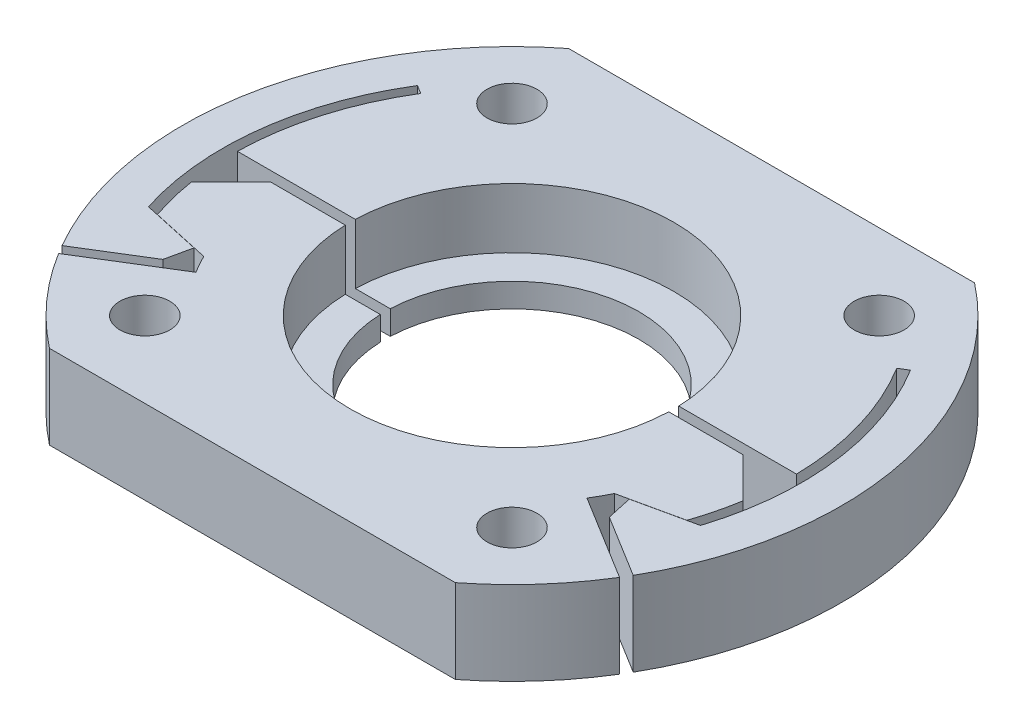
from build123d import *

# Parameters (mm, degrees)
SKETCH4_R            = 1.2
CUT_EXTRUDE2_DEPTH   = 27.711420778
SKETCH4_3_R          = 2.25
SKETCH4_3_R_2        = 1.2
CUT_EXTRUDE3_DEPTH   = 9.4
CHAMFER1_SIZE        = 1
SKETCH2_W            = 41.708786628
SKETCH2_H            = 54.576605706
CUT_EXTRUDE1_DEPTH   = 0.05
SKETCH1_5_W          = 8.4
SKETCH1_5_H          = 3
SKETCH1_5_H_2        = 1.2
SKETCH10_R           = 1.25
CUT_EXTRUDE9_DEPTH   = 24.951200387
CUT_EXTRUDE6_START   = -5.4
CUT_EXTRUDE6_DEPTH   = 5.4
CUT_EXTRUDE7_DEPTH   = 1.2
SKETCH11_OUTSIDE_W   = 44.372
SKETCH11_OUTSIDE_H   = 44.372
SKETCH11_OUTSIDE_W_2 = 60
SKETCH11_OUTSIDE_H_2 = 26
CUT_EXTRUDE10_DEPTH  = 24.70949177


# Read off the part's stored shape, not the designer's step: Cut-Extrude6
with BuildPart() as part:
    # Sketch1 → Revolve1 (revolve)
    with BuildSketch(Plane.XY, mode=Mode.PRIVATE) as revolve1_sk:
        Polygon((-3, 0), (-8, 0), (-8, -3.7), (-6, -3.7), (-6, -9.7), (-8, -9.7), (-8, -13), (-16.5, -13), (-16.5, -23.9), (-6.1, -23.9), (-6.1, -21), (-8.1, -21), (-8.1, -14.3), (-3, -14.3), align=None)
    revolve(revolve1_sk.sketch.rotate(Axis((0, 21.737527327, 0), (0, -1, 0)), 270), axis=Axis((0, 21.737527327, 0), (0, -1, 0)))

    # Sketch4 → Cut-Extrude2 (cut, through all)
    with BuildSketch(Plane(origin=(0, -13, 0), x_dir=(1, 0, 0), z_dir=(0, 1, 0))):
        with Locations(Location((-9.192388155, 9.192388155, 0), (0, 0, 270))):
            Circle(SKETCH4_R)
        with Locations(Location((9.192388155, 9.192388155, 0), (0, 0, 270))):
            Circle(SKETCH4_R)
        with Locations(Location((9.192388155, -9.192388155, 0), (0, 0, 270))):
            Circle(SKETCH4_R)
        with Locations(Location((-9.192388155, -9.192388155, 0), (0, 0, 270))):
            Circle(SKETCH4_R)
    extrude(amount=-CUT_EXTRUDE2_DEPTH, mode=Mode.SUBTRACT)

    # Sketch4<3> → Cut-Extrude3 (cut)
    # profile 1 of 5: a face of its own
    with BuildSketch(Plane(origin=(0, -13, 0), x_dir=(1, 0, 0), z_dir=(0, 1, 0))):
        with Locations(Location((9.192388155, 9.192388155, 0), (0, 0, 270))):
            Circle(SKETCH4_3_R)
        with Locations(Location((9.192388155, 9.192388155, 0), (0, 0, 270))):
            Circle(SKETCH4_3_R_2, mode=Mode.SUBTRACT)
    # profile 2 of 5: a face of its own
    with BuildSketch(Plane(origin=(0, -13, 0), x_dir=(1, 0, 0), z_dir=(0, 1, 0))):
        with Locations(Location((9.192388155, -9.192388155, 0), (0, 0, 270))):
            Circle(SKETCH4_3_R)
        with Locations(Location((9.192388155, -9.192388155, 0), (0, 0, 270))):
            Circle(SKETCH4_3_R_2, mode=Mode.SUBTRACT)
    # profile 3 of 5: a face of its own
    with BuildSketch(Plane(origin=(0, -13, 0), x_dir=(1, 0, 0), z_dir=(0, 1, 0))):
        with Locations(Location((-9.192388155, -9.192388155, 0), (0, 0, 270))):
            Circle(SKETCH4_3_R)
        with Locations(Location((-9.192388155, -9.192388155, 0), (0, 0, 270))):
            Circle(SKETCH4_3_R_2, mode=Mode.SUBTRACT)
    # profile 4 of 5: a face of its own
    with BuildSketch(Plane(origin=(0, -13, 0), x_dir=(1, 0, 0), z_dir=(0, 1, 0))):
        with Locations(Location((-9.192388155, 9.192388155, 0), (0, 0, 270))):
            Circle(SKETCH4_3_R_2)
    # profile 5 of 5: a face of its own
    with BuildSketch(Plane(origin=(0, -13, 0), x_dir=(1, 0, 0), z_dir=(0, 1, 0))):
        with Locations(Location((-9.192388155, 9.192388155, 0), (0, 0, 270))):
            Circle(SKETCH4_3_R)
    extrude(amount=-CUT_EXTRUDE3_DEPTH, mode=Mode.SUBTRACT)

    # Chamfer1
    chamfer1_edges = [part.edges().sort_by_distance(p)[0] for p in [
        (0, 0, -3),
    ]]
    chamfer(chamfer1_edges, length=CHAMFER1_SIZE)

    # Sketch2 → Cut-Extrude1 (cut, symmetric)
    with BuildSketch(Plane.XY):
        Rectangle(SKETCH2_W, SKETCH2_H)
    extrude(amount=CUT_EXTRUDE1_DEPTH, both=True, mode=Mode.SUBTRACT)


with BuildPart() as cut_extrude1_piece_1:
    # of the separate pieces the step leaves, piece 1, a body of its own (cut_extrude1_pieces)
    add(part.part.solids().sort_by_distance((-2.999583304, -1, 0.05))[0])


with BuildPart() as cut_extrude1_piece_2:
    # of the separate pieces the step leaves, piece 2, a body of its own (cut_extrude1_pieces)
    add(part.part.solids().sort_by_distance((-2.999583304, -1, -0.05))[0])


with BuildPart() as body_3:
    # Sketch1<5> → Revolve2 (revolve)
    with BuildSketch(Plane.XY, mode=Mode.PRIVATE) as revolve2_sk:
        with Locations((-12.3, -25.5)):
            Rectangle(SKETCH1_5_W, SKETCH1_5_H)
        Polygon((-6.35, -27), (-8.1, -27), (-16.5, -27), (-16.5, -28.2), (-8.1, -28.2), (-6.35, -28.2), align=None)
        with Locations((-12.3, -28.8)):
            Rectangle(SKETCH1_5_W, SKETCH1_5_H_2)
    revolve(revolve2_sk.sketch.rotate(Axis((0, 21.737527327, 0), (0, -1, 0)), 270), axis=Axis((0, 21.737527327, 0), (0, -1, 0)))

    # Sketch10 → Cut-Extrude9 (cut, through all)
    with BuildSketch(Plane.XZ.offset(29.4)):
        with Locations(Location((-9.192388155, 9.192388155, 0), (0, 0, 270))):
            Circle(SKETCH10_R)
        with Locations(Location((9.192388155, 9.192388155, 0), (0, 0, 270))):
            Circle(SKETCH10_R)
        with Locations(Location((9.192388155, -9.192388155, 0), (0, 0, 270))):
            Circle(SKETCH10_R)
        with Locations(Location((-9.192388155, -9.192388155, 0), (0, 0, 270))):
            Circle(SKETCH10_R)
    extrude(amount=-CUT_EXTRUDE9_DEPTH, mode=Mode.SUBTRACT)

    # Cut-Extrude6 outline → Cut-Extrude6 (cut)
    with BuildSketch(Plane(origin=(0, -24, 0), x_dir=(1, 0, 0), z_dir=(0, 1, 0)).offset(CUT_EXTRUDE6_START)):
        with BuildLine():
            ThreePointArc((-6.345076832, -0.25), (-6.35, 0), (-6.345076832, 0.25))
            Line((-6.345076832, 0.25), (-13.997767679, 0.25))
            ThreePointArc((-13.997767679, 0.25), (-13.434499109, 3.938811204), (-11.916791658, 7.347793995))
            Line((-11.916791658, 7.347793995), (-12.34239136, 7.610215209))
            ThreePointArc((-12.34239136, 7.610215209), (-14.390898722, 1.775396852), (-13.821906079, -4.382340966))
            Line((-13.821906079, -4.382340966), (-10.896795834, -5.025916887))
            Line((-10.896795834, -5.025916887), (-11.178213769, -6.304986624))
            Line((-11.178213769, -6.304986624), (-14.300761421, -8.230323371))
            ThreePointArc((-14.300761421, -8.230323371), (-14.174403259, -8.446081473), (-14.044790168, -8.659900065))
            Line((-14.044790168, -8.659900065), (-9.788793147, -6.035687924))
            ThreePointArc((-9.788793147, -6.035687924), (-10.045093899, -5.598757771), (-10.281904658, -5.150964628))
            Line((-10.281904658, -5.150964628), (-13.258402706, -4.496082483))
            ThreePointArc((-13.258402706, -4.496082483), (-13.584708377, -3.38462676), (-13.818013605, -2.25))
            Line((-13.818013605, -2.25), (-11.818013605, -0.25))
            Line((-11.818013605, -0.25), (-6.345076832, -0.25))
        make_face()
    cut_extrude6 = extrude(amount=CUT_EXTRUDE6_DEPTH, mode=Mode.SUBTRACT)

    # Sketch8 → Cut-Extrude7 (cut)
    with BuildSketch(Plane.XZ.offset(29.4)):
        with BuildLine():
            Line((-11.818013605, 0.25), (-8.096141056, 0.25))
            ThreePointArc((-8.096141056, 0.25), (8.1, 0), (-8.096141056, -0.25))
            Line((-8.096141056, -0.25), (-13.997767679, -0.25))
            ThreePointArc((-13.997767679, -0.25), (-13.434499109, -3.938811203), (-11.916791658, -7.347793995))
            Line((-11.916791658, -7.347793995), (-12.34239136, -7.610215209))
            ThreePointArc((-12.34239136, -7.610215209), (-14.390898722, -1.775396852), (-13.821906079, 4.382340966))
            Line((-13.821906079, 4.382340966), (-10.896795834, 5.025916887))
            Line((-10.896795834, 5.025916887), (-11.178213769, 6.304986624))
            Line((-11.178213769, 6.304986624), (-14.300761421, 8.230323371))
            ThreePointArc((-14.300761421, 8.230323371), (14.174403259, -8.446081473), (-14.044790168, 8.659900065))
            Line((-14.044790168, 8.659900065), (-9.788793147, 6.035687924))
            ThreePointArc((-9.788793147, 6.035687924), (-10.045093899, 5.59875777), (-10.281904658, 5.150964628))
            Line((-10.281904658, 5.150964628), (-13.258402706, 4.496082483))
            ThreePointArc((-13.258402706, 4.496082483), (-13.584708377, 3.38462676), (-13.818013605, 2.25))
            Line((-13.818013605, 2.25), (-11.818013605, 0.25))
        make_face()
    extrude(amount=-CUT_EXTRUDE7_DEPTH, mode=Mode.SUBTRACT)

    # Mirror2: Cut-Extrude6 across plane
    add(cut_extrude6.mirror(Plane(origin=(0, 0, 0), x_dir=(0, 0, 1), z_dir=(1, 0, 0))), mode=Mode.SUBTRACT)

    # Sketch11 outside → Cut-Extrude10 (cut, through all)
    with BuildSketch(Plane(origin=(0, -24, 0), x_dir=(1, 0, 0), z_dir=(0, 1, 0))):
        Rectangle(SKETCH11_OUTSIDE_W, SKETCH11_OUTSIDE_H)
        Rectangle(SKETCH11_OUTSIDE_W_2, SKETCH11_OUTSIDE_H_2, mode=Mode.SUBTRACT)
    extrude(amount=-CUT_EXTRUDE10_DEPTH, mode=Mode.SUBTRACT)


solid = body_3.part
